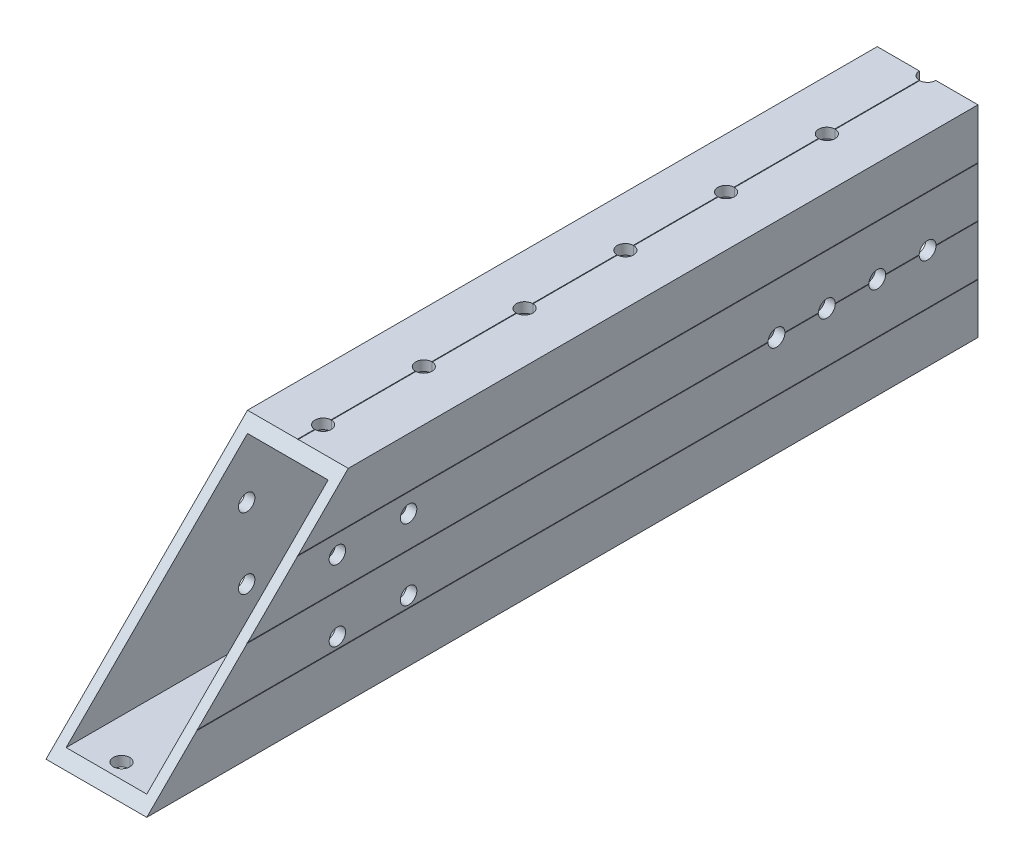
from build123d import *

# Parameters (mm, degrees)
CUT_EXTRUDE1_START          = -25.4
CUT_EXTRUDE1_OUTLINE_W      = 2.54
CUT_EXTRUDE1_OUTLINE_H      = 609.6
CUT_EXTRUDE1_DEPTH          = 50.8
CUT_EXTRUDE1_2_OUTLINE_W    = 20.32
CUT_EXTRUDE1_2_OUTLINE_H    = 609.6
CUT_EXTRUDE1_2_OUTLINE_R    = 2.0701
CUT_EXTRUDE1_2_DEPTH        = 2.54
CUT_EXTRUDE1_START_2        = 22.86
CUT_EXTRUDE1_3_OUTLINE_W    = 20.32
CUT_EXTRUDE1_3_OUTLINE_H    = 609.6
CUT_EXTRUDE1_3_OUTLINE_R    = 2.0701
CUT_EXTRUDE1_3_DEPTH        = 2.54
CUT_EXTRUDE1_START_3        = -17.906630705
CUT_EXTRUDE1_4_OUTLINE_W    = 8.980256121
CUT_EXTRUDE1_4_OUTLINE_H    = 613
CUT_EXTRUDE1_4_DEPTH        = 8.980256121
CUT_EXTRUDE1_START_4        = 8.926374584
CUT_EXTRUDE1_5_OUTLINE_W    = 8.980256121
CUT_EXTRUDE1_5_OUTLINE_H    = 613
CUT_EXTRUDE1_5_DEPTH        = 0.107763074
CUT_EXTRUDE1_START_5        = -0.053881537
CUT_EXTRUDE1_6_OUTLINE_W    = 2.093369295
CUT_EXTRUDE1_6_OUTLINE_H    = 613
CUT_EXTRUDE1_6_DEPTH        = 0.107763074
CUT_EXTRUDE1_START_6        = -26.940768363
CUT_EXTRUDE1_7_OUTLINE_W    = 2.093369295
CUT_EXTRUDE1_7_OUTLINE_H    = 613
CUT_EXTRUDE1_7_OUTLINE_W_2  = 0.107763074
CUT_EXTRUDE1_7_DEPTH        = 9.034137658
CUT_EXTRUDE1_START_7        = 17.906630705
CUT_EXTRUDE1_8_OUTLINE_W    = 0.107763074
CUT_EXTRUDE1_8_OUTLINE_H    = 613
CUT_EXTRUDE1_8_OUTLINE_W_2  = 2.093369295
CUT_EXTRUDE1_8_DEPTH        = 9.034137658
SKETCH2_W                   = 25.4
SKETCH2_H                   = 50.8
CUT_EXTRUDE2_DEPTH          = 387.35
SKETCH3_W                   = 25.4
SKETCH3_H                   = 50.8
CUT_EXTRUDE3_DEPTH          = 12.7
CUT_EXTRUDE4_REACH          = 739.475
F_1_4_0_25_DIAMETER_HOLE2_D = 4.2545
F_1_4_0_25_DIAMETER_HOLE3_D = 4.1402


with BuildPart() as part:
    # Cut-Extrude1: read off the stored shape, not the designer's step
    # Cut-Extrude1 outline → Cut-Extrude1 (new body)
    with BuildSketch(Plane(origin=(0, 0, 0), x_dir=(1, 0, 0), z_dir=(0, 1, 0)).offset(CUT_EXTRUDE1_START)):
        with Locations((-11.43, 444.5)):
            Rectangle(CUT_EXTRUDE1_OUTLINE_W, CUT_EXTRUDE1_OUTLINE_H)
        with Locations((11.43, 444.5)):
            Rectangle(CUT_EXTRUDE1_OUTLINE_W, CUT_EXTRUDE1_OUTLINE_H)
    extrude(amount=CUT_EXTRUDE1_DEPTH)

    # Cut-Extrude1 2 outline → Cut-Extrude1 2 (add)
    with BuildSketch(Plane(origin=(0, 0, 0), x_dir=(1, 0, 0), z_dir=(0, 1, 0)).offset(CUT_EXTRUDE1_START)):
        with Locations((0, 444.5)):
            Rectangle(CUT_EXTRUDE1_2_OUTLINE_W, CUT_EXTRUDE1_2_OUTLINE_H)
        with Locations((0, 152.4)):
            Circle(CUT_EXTRUDE1_2_OUTLINE_R, mode=Mode.SUBTRACT)
        with Locations((0, 177.8)):
            Circle(CUT_EXTRUDE1_2_OUTLINE_R, mode=Mode.SUBTRACT)
        with Locations((0, 203.2)):
            Circle(CUT_EXTRUDE1_2_OUTLINE_R, mode=Mode.SUBTRACT)
        with Locations((0, 228.6)):
            Circle(CUT_EXTRUDE1_2_OUTLINE_R, mode=Mode.SUBTRACT)
        with Locations((0, 254)):
            Circle(CUT_EXTRUDE1_2_OUTLINE_R, mode=Mode.SUBTRACT)
        with Locations((0, 279.4)):
            Circle(CUT_EXTRUDE1_2_OUTLINE_R, mode=Mode.SUBTRACT)
        with Locations((0, 304.8)):
            Circle(CUT_EXTRUDE1_2_OUTLINE_R, mode=Mode.SUBTRACT)
        with Locations((0, 330.2)):
            Circle(CUT_EXTRUDE1_2_OUTLINE_R, mode=Mode.SUBTRACT)
        with Locations((0, 355.6)):
            Circle(CUT_EXTRUDE1_2_OUTLINE_R, mode=Mode.SUBTRACT)
        with Locations((0, 381)):
            Circle(CUT_EXTRUDE1_2_OUTLINE_R, mode=Mode.SUBTRACT)
        with Locations((0, 406.4)):
            Circle(CUT_EXTRUDE1_2_OUTLINE_R, mode=Mode.SUBTRACT)
        with Locations((0, 431.8)):
            Circle(CUT_EXTRUDE1_2_OUTLINE_R, mode=Mode.SUBTRACT)
        with Locations((0, 457.2)):
            Circle(CUT_EXTRUDE1_2_OUTLINE_R, mode=Mode.SUBTRACT)
        with Locations((0, 482.6)):
            Circle(CUT_EXTRUDE1_2_OUTLINE_R, mode=Mode.SUBTRACT)
        with Locations((0, 508)):
            Circle(CUT_EXTRUDE1_2_OUTLINE_R, mode=Mode.SUBTRACT)
        with Locations((0, 533.4)):
            Circle(CUT_EXTRUDE1_2_OUTLINE_R, mode=Mode.SUBTRACT)
        with Locations((0, 558.8)):
            Circle(CUT_EXTRUDE1_2_OUTLINE_R, mode=Mode.SUBTRACT)
        with Locations((0, 584.2)):
            Circle(CUT_EXTRUDE1_2_OUTLINE_R, mode=Mode.SUBTRACT)
        with Locations((0, 609.6)):
            Circle(CUT_EXTRUDE1_2_OUTLINE_R, mode=Mode.SUBTRACT)
        with Locations((0, 635)):
            Circle(CUT_EXTRUDE1_2_OUTLINE_R, mode=Mode.SUBTRACT)
        with Locations((0, 660.4)):
            Circle(CUT_EXTRUDE1_2_OUTLINE_R, mode=Mode.SUBTRACT)
        with Locations((0, 685.8)):
            Circle(CUT_EXTRUDE1_2_OUTLINE_R, mode=Mode.SUBTRACT)
        with Locations((0, 711.2)):
            Circle(CUT_EXTRUDE1_2_OUTLINE_R, mode=Mode.SUBTRACT)
        with Locations((0, 736.6)):
            Circle(CUT_EXTRUDE1_2_OUTLINE_R, mode=Mode.SUBTRACT)
    extrude(amount=CUT_EXTRUDE1_2_DEPTH)

    # Cut-Extrude1 3 outline → Cut-Extrude1 3 (add)
    with BuildSketch(Plane(origin=(0, 0, 0), x_dir=(1, 0, 0), z_dir=(0, 1, 0)).offset(CUT_EXTRUDE1_START_2)):
        with Locations((0, 444.5)):
            Rectangle(CUT_EXTRUDE1_3_OUTLINE_W, CUT_EXTRUDE1_3_OUTLINE_H)
        with Locations((0, 152.4)):
            Circle(CUT_EXTRUDE1_3_OUTLINE_R, mode=Mode.SUBTRACT)
        with Locations((0, 177.8)):
            Circle(CUT_EXTRUDE1_3_OUTLINE_R, mode=Mode.SUBTRACT)
        with Locations((0, 203.2)):
            Circle(CUT_EXTRUDE1_3_OUTLINE_R, mode=Mode.SUBTRACT)
        with Locations((0, 228.6)):
            Circle(CUT_EXTRUDE1_3_OUTLINE_R, mode=Mode.SUBTRACT)
        with Locations((0, 254)):
            Circle(CUT_EXTRUDE1_3_OUTLINE_R, mode=Mode.SUBTRACT)
        with Locations((0, 279.4)):
            Circle(CUT_EXTRUDE1_3_OUTLINE_R, mode=Mode.SUBTRACT)
        with Locations((0, 304.8)):
            Circle(CUT_EXTRUDE1_3_OUTLINE_R, mode=Mode.SUBTRACT)
        with Locations((0, 330.2)):
            Circle(CUT_EXTRUDE1_3_OUTLINE_R, mode=Mode.SUBTRACT)
        with Locations((0, 355.6)):
            Circle(CUT_EXTRUDE1_3_OUTLINE_R, mode=Mode.SUBTRACT)
        with Locations((0, 381)):
            Circle(CUT_EXTRUDE1_3_OUTLINE_R, mode=Mode.SUBTRACT)
        with Locations((0, 406.4)):
            Circle(CUT_EXTRUDE1_3_OUTLINE_R, mode=Mode.SUBTRACT)
        with Locations((0, 431.8)):
            Circle(CUT_EXTRUDE1_3_OUTLINE_R, mode=Mode.SUBTRACT)
        with Locations((0, 457.2)):
            Circle(CUT_EXTRUDE1_3_OUTLINE_R, mode=Mode.SUBTRACT)
        with Locations((0, 482.6)):
            Circle(CUT_EXTRUDE1_3_OUTLINE_R, mode=Mode.SUBTRACT)
        with Locations((0, 508)):
            Circle(CUT_EXTRUDE1_3_OUTLINE_R, mode=Mode.SUBTRACT)
        with Locations((0, 533.4)):
            Circle(CUT_EXTRUDE1_3_OUTLINE_R, mode=Mode.SUBTRACT)
        with Locations((0, 558.8)):
            Circle(CUT_EXTRUDE1_3_OUTLINE_R, mode=Mode.SUBTRACT)
        with Locations((0, 584.2)):
            Circle(CUT_EXTRUDE1_3_OUTLINE_R, mode=Mode.SUBTRACT)
        with Locations((0, 609.6)):
            Circle(CUT_EXTRUDE1_3_OUTLINE_R, mode=Mode.SUBTRACT)
        with Locations((0, 635)):
            Circle(CUT_EXTRUDE1_3_OUTLINE_R, mode=Mode.SUBTRACT)
        with Locations((0, 660.4)):
            Circle(CUT_EXTRUDE1_3_OUTLINE_R, mode=Mode.SUBTRACT)
        with Locations((0, 685.8)):
            Circle(CUT_EXTRUDE1_3_OUTLINE_R, mode=Mode.SUBTRACT)
        with Locations((0, 711.2)):
            Circle(CUT_EXTRUDE1_3_OUTLINE_R, mode=Mode.SUBTRACT)
        with Locations((0, 736.6)):
            Circle(CUT_EXTRUDE1_3_OUTLINE_R, mode=Mode.SUBTRACT)
    extrude(amount=CUT_EXTRUDE1_3_DEPTH)

    # Cut-Extrude1 4 outline → Cut-Extrude1 4 (cut)
    with BuildSketch(Plane(origin=(0, 0, 0), x_dir=(0.7071067811865493, 0.7071067811865457, 0), z_dir=(0.7071067811865456, -0.7071067811865496, 0)).offset(CUT_EXTRUDE1_START_3)):
        with Locations((-13.416502645, -444.5)):
            Rectangle(CUT_EXTRUDE1_4_OUTLINE_W, CUT_EXTRUDE1_4_OUTLINE_H)
    extrude(amount=CUT_EXTRUDE1_4_DEPTH, mode=Mode.SUBTRACT)

    # Cut-Extrude1 5 outline → Cut-Extrude1 5 (cut)
    with BuildSketch(Plane(origin=(0, 0, 0), x_dir=(0.7071067811865493, 0.7071067811865457, 0), z_dir=(0.7071067811865456, -0.7071067811865496, 0)).offset(CUT_EXTRUDE1_START_4)):
        with Locations((13.416502645, -444.5)):
            Rectangle(CUT_EXTRUDE1_5_OUTLINE_W, CUT_EXTRUDE1_5_OUTLINE_H)
    extrude(amount=CUT_EXTRUDE1_5_DEPTH, mode=Mode.SUBTRACT)

    # Cut-Extrude1 6 outline → Cut-Extrude1 6 (cut)
    with BuildSketch(Plane(origin=(0, 0, 0), x_dir=(0.7071067811865493, 0.7071067811865457, 0), z_dir=(0.7071067811865456, -0.7071067811865496, 0)).offset(CUT_EXTRUDE1_START_5)):
        with Locations((18.953315352, -444.5)):
            Rectangle(CUT_EXTRUDE1_6_OUTLINE_W, CUT_EXTRUDE1_6_OUTLINE_H)
        with Locations((-18.953315352, -444.5)):
            Rectangle(CUT_EXTRUDE1_6_OUTLINE_W, CUT_EXTRUDE1_6_OUTLINE_H)
    extrude(amount=CUT_EXTRUDE1_6_DEPTH, mode=Mode.SUBTRACT)

    # Cut-Extrude1 7 outline → Cut-Extrude1 7 (cut)
    with BuildSketch(Plane(origin=(0, 0, 0), x_dir=(0.7071067811865493, 0.7071067811865457, 0), z_dir=(0.7071067811865456, -0.7071067811865496, 0)).offset(CUT_EXTRUDE1_START_6)):
        with Locations((18.953315352, -444.5)):
            Rectangle(CUT_EXTRUDE1_7_OUTLINE_W, CUT_EXTRUDE1_7_OUTLINE_H)
        with Locations((0, -444.5)):
            Rectangle(CUT_EXTRUDE1_7_OUTLINE_W_2, CUT_EXTRUDE1_7_OUTLINE_H)
    extrude(amount=CUT_EXTRUDE1_7_DEPTH, mode=Mode.SUBTRACT)

    # Cut-Extrude1 8 outline → Cut-Extrude1 8 (cut)
    with BuildSketch(Plane(origin=(0, 0, 0), x_dir=(0.7071067811865493, 0.7071067811865457, 0), z_dir=(0.7071067811865456, -0.7071067811865496, 0)).offset(CUT_EXTRUDE1_START_7)):
        with Locations((0, -444.5)):
            Rectangle(CUT_EXTRUDE1_8_OUTLINE_W, CUT_EXTRUDE1_8_OUTLINE_H)
        with Locations((-18.953315352, -444.5)):
            Rectangle(CUT_EXTRUDE1_8_OUTLINE_W_2, CUT_EXTRUDE1_8_OUTLINE_H)
    extrude(amount=CUT_EXTRUDE1_8_DEPTH, mode=Mode.SUBTRACT)

    # Sketch2 → Cut-Extrude2 (cut)
    with BuildSketch(Plane.XY.offset(-139.7)):
        Rectangle(SKETCH2_W, SKETCH2_H)
    extrude(amount=-CUT_EXTRUDE2_DEPTH, mode=Mode.SUBTRACT)

    # Sketch3 → Cut-Extrude3 (cut)
    with BuildSketch(Plane(origin=(0, 0, -749.3), x_dir=(-1, 0, 0), z_dir=(0, 0, -1))):
        Rectangle(SKETCH3_W, SKETCH3_H)
    extrude(amount=-CUT_EXTRUDE3_DEPTH, mode=Mode.SUBTRACT)

    # Cut-Extrude4: up to this face of the body (flat: up to its plane)
    cut_extrude4_end = Plane(part.part.faces().sort_by_distance((12.7, -19.0881, -631.825))[0])
    # Sketch4 → Cut-Extrude4 (cut, up to the picked face)
    with BuildSketch(Plane.ZY.offset(12.7), mode=Mode.PRIVATE) as cut_extrude4_sk1:
        Polygon((-527.05, -25.4), (-577.85, 25.4), (-527.05, 25.4), align=None)
    cut_extrude4_tool1 = split(extrude(cut_extrude4_sk1.sketch, amount=-CUT_EXTRUDE4_REACH, mode=Mode.PRIVATE), bisect_by=cut_extrude4_end, keep=Keep.BOTH, mode=Mode.PRIVATE)
    add(cut_extrude4_tool1.solids().sort_by(Axis((-12.7, 8.466667, -543.983333), (1, 0, 0)))[0], mode=Mode.SUBTRACT)

    # 1/4 (0.25) Diameter Hole2 (through all)
    with Locations(Plane(origin=(12.7, 0, 0), x_dir=(0, 0, -1), z_dir=(1, 0, 0))):
        with Locations((723.9, 0), (711.2, 0), (698.5, 0), (685.8, 0)):
            Hole(F_1_4_0_25_DIAMETER_HOLE2_D / 2)

    # 1/4 (0.25) Diameter Hole3 (through all)
    with Locations(Plane.ZY.offset(12.7)):
        with Locations((-593.062370896, -9.9356037), (-575.101858684, -9.9356037), (-575.102071282, 7.915102026), (-593.062583494, 7.915102026)):
            Hole(F_1_4_0_25_DIAMETER_HOLE3_D / 2)


solid = part.part
